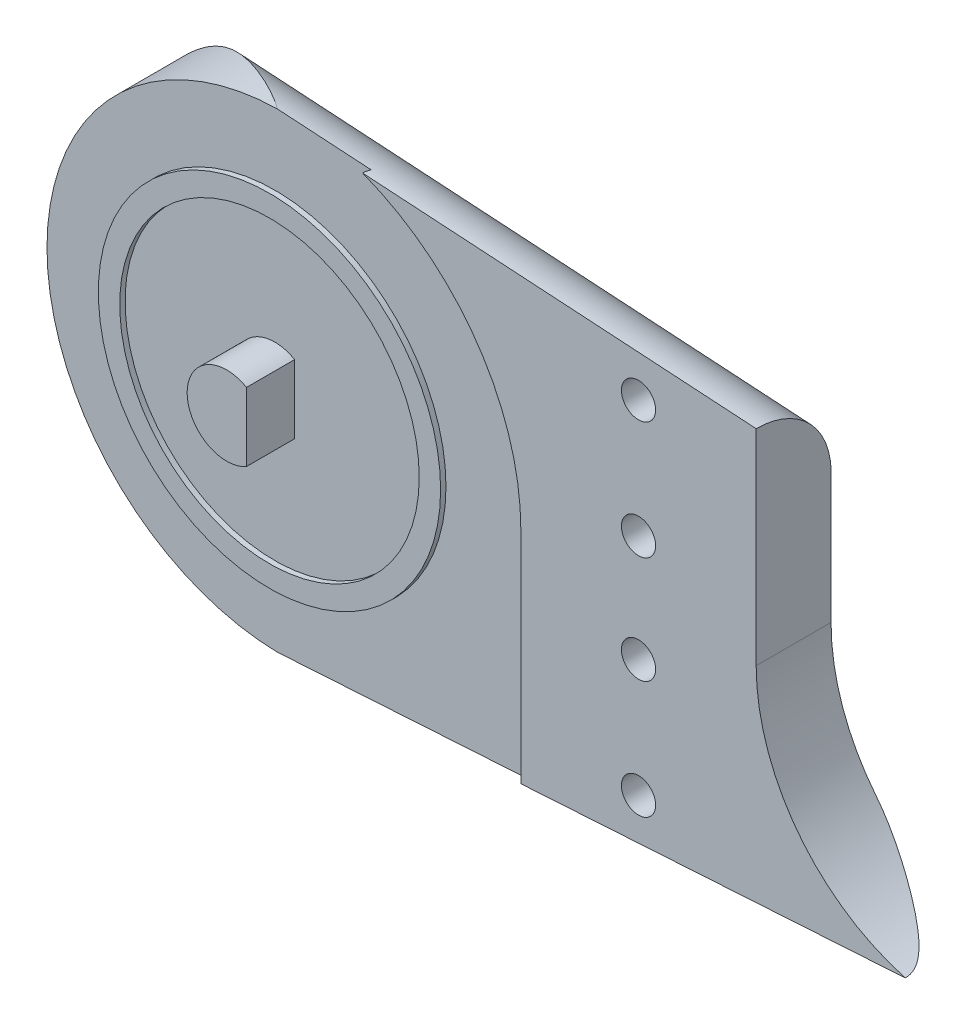
from build123d import *

# Parameters (mm, degrees)
BOSS_EXTRUDE1_DEPTH = 3.5
JOINT_START         = 3.5
SKETCH7_R           = 11.5
JOINT_HOLE_DEPTH    = 0.35
POT_START           = 3.5
POT_INSERT_DEPTH    = 2.25
FRICTION_START      = 3.5
SKETCH4_R           = 8
SKETCH4_R_2         = 7
FRICTION_DEPTH      = 0.25
SKETCH2_R           = 0.8
SCREW_HOLES_DEPTH   = 45.755586244
SKETCH8_R           = 1.25
SCREW_HEADS_DEPTH   = 2
FILLET1_START       = -42.937682511
FILLET1_DEPTH       = 40.937682511
FILLET1_2_DEPTH     = 33.456183015


with BuildPart() as part:
    # Sketch1 → Boss-Extrude1 (new body)
    with BuildSketch(Plane.XY):
        with BuildLine():
            ThreePointArc((-2.526427532, -9.157901721), (-7.558143342, -5.755386106), (-9.5, 0))
            Line((-9.5, 0), (-9.5, 9.59375))
            Line((-9.5, 9.59375), (-32, 11))
            ThreePointArc((-32, 11), (-43, 0), (-32, -11))
            Line((-32, -11), (-2.526427532, -9.157901721))
        make_face()
    extrude(amount=BOSS_EXTRUDE1_DEPTH)

    # Sketch7 → Joint Hole (cut)
    with BuildSketch(Plane.XY.offset(JOINT_START)):
        with Locations((-32, 0)):
            Circle(SKETCH7_R)
        with BuildLine():
            Line((-20.5, -11.5), (-20.5, 0))
            ThreePointArc((-20.5, 0), (-23.868272016, -8.131727984), (-32, -11.5))
            Line((-32, -11.5), (-20.5, -11.5))
        make_face()
    extrude(amount=-JOINT_HOLE_DEPTH, mode=Mode.SUBTRACT)

    # Sketch2 → Screw Holes (cut, through all)
    with BuildSketch(Plane.XY):
        with Locations((-15, 8)):
            Circle(SKETCH2_R)
        with Locations((-15, -8)):
            Circle(SKETCH2_R)
        with Locations((-15, 2.5)):
            Circle(SKETCH2_R)
        with Locations((-15, -2.5)):
            Circle(SKETCH2_R)
    extrude(amount=SCREW_HOLES_DEPTH, mode=Mode.SUBTRACT)

    # Sketch8 → Screw Heads (cut)
    with BuildSketch(Plane.XY):
        with Locations((-15, 2.5)):
            Circle(SKETCH8_R)
        with Locations((-15, -2.5)):
            Circle(SKETCH8_R)
    extrude(amount=SCREW_HEADS_DEPTH, mode=Mode.SUBTRACT)

    # Fillet1: read off the stored shape, not the designer's step
    # Fillet1 outline → Fillet1 (cut)
    with BuildSketch(Plane(origin=(0, 0, 0), x_dir=(-0.062378286155180485, 0.9980525784828886, 0), z_dir=(0.9980525784828886, 0.06237828615518048, 0)).offset(FILLET1_START)):
        with BuildLine():
            ThreePointArc((-5.482473206, 0), (-7.95734694, 1.025126266), (-8.982473206, 3.5))
            Line((-8.982473206, 3.5), (-8.982473206, 0))
            Line((-8.982473206, 0), (-5.482473206, 0))
        make_face()
    extrude(amount=FILLET1_DEPTH, mode=Mode.SUBTRACT)

    # Fillet1 2 outline → Fillet1 2 (cut)
    with BuildSketch(Plane(origin=(0, 0, 0), x_dir=(0.062378286155180485, 0.9980525784828886, 0), z_dir=(0.9980525784828886, -0.06237828615518048, 0)).offset(FILLET1_START)):
        with BuildLine():
            Line((8.982473206, 0), (8.982473206, 3.5))
            ThreePointArc((8.982473206, 3.5), (7.95734694, 1.025126266), (5.482473206, 0))
            Line((5.482473206, 0), (8.982473206, 0))
        make_face()
    extrude(amount=FILLET1_2_DEPTH, mode=Mode.SUBTRACT)


with BuildPart() as body_2:
    # Sketch5 → Pot Insert (new body)
    with BuildSketch(Plane.XY.offset(POT_START)):
        with BuildLine():
            Line((-31.075, -1.602146997), (-31.075, 1.602146997))
            ThreePointArc((-31.075, 1.602146997), (-33.85, 0), (-31.075, -1.602146997))
        make_face()
    extrude(amount=POT_INSERT_DEPTH)


with BuildPart() as body_3:
    # Sketch4 → Friction (new body)
    with BuildSketch(Plane.XY.offset(FRICTION_START)):
        with Locations((-32, 0)):
            Circle(SKETCH4_R)
        with Locations((-32, 0)):
            Circle(SKETCH4_R_2, mode=Mode.SUBTRACT)
    extrude(amount=FRICTION_DEPTH)


solid = Compound([part.part, body_2.part, body_3.part])
